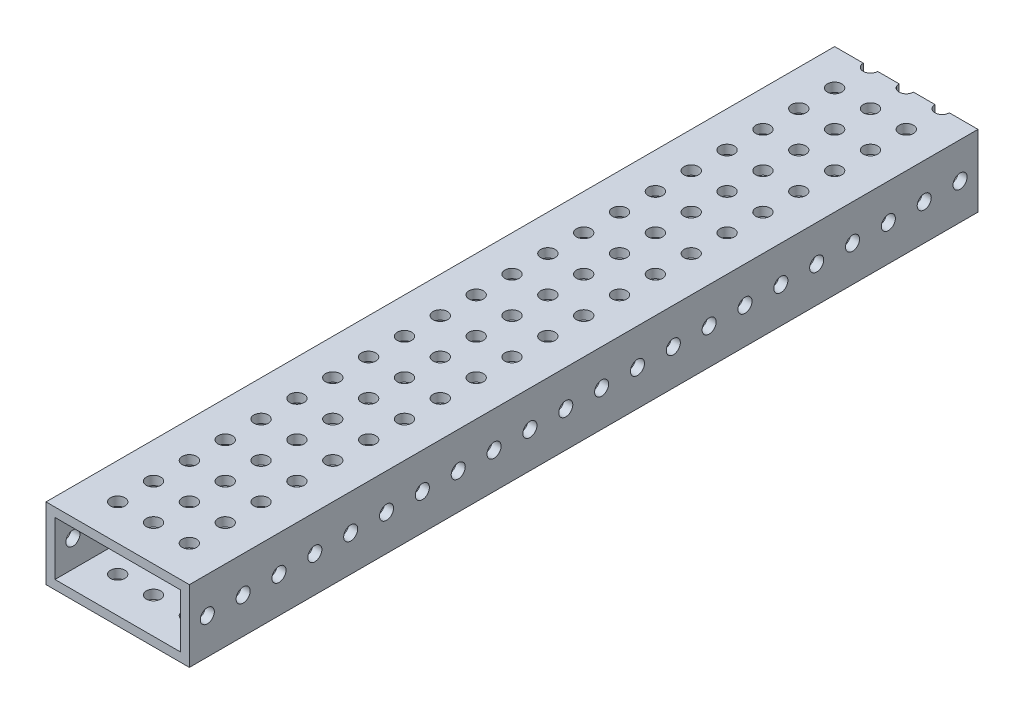
from build123d import *

# Parameters (mm, degrees)
SKETCH1_W           = 50.8
SKETCH1_H           = 25.4
SKETCH1_W_2         = 44.45
SKETCH1_H_2         = 19.05
BOSS_EXTRUDE1_DEPTH = 139.7
SKETCH2_R           = 2.5527
CUT_EXTRUDE1_DEPTH  = 145.244271983
SKETCH4_R           = 2.4892
CUT_EXTRUDE3_DEPTH  = 150.191219581


with BuildPart() as part:
    # Sketch1 → Boss-Extrude1 (new, symmetric)
    with BuildSketch(Plane.XY):
        Rectangle(SKETCH1_W, SKETCH1_H)
        Rectangle(SKETCH1_W_2, SKETCH1_H_2, mode=Mode.SUBTRACT)
    extrude(amount=BOSS_EXTRUDE1_DEPTH, both=True)

    # Sketch2 → Cut-Extrude1 (cut, through all)
    with BuildSketch(Plane(origin=(0, 12.7, 0), x_dir=(1, 0, 0), z_dir=(0, 1, 0))):
        with Locations((0, -127)):
            Circle(SKETCH2_R)
        with Locations((12.7, -127)):
            Circle(SKETCH2_R)
        with Locations((-12.7, -127)):
            Circle(SKETCH2_R)
        with Locations((-12.7, -114.3)):
            Circle(SKETCH2_R)
        with Locations((0, -114.3)):
            Circle(SKETCH2_R)
        with Locations((12.7, -114.3)):
            Circle(SKETCH2_R)
        with Locations((-12.7, -101.6)):
            Circle(SKETCH2_R)
        with Locations((0, -101.6)):
            Circle(SKETCH2_R)
        with Locations((12.7, -101.6)):
            Circle(SKETCH2_R)
        with Locations((-12.7, -88.9)):
            Circle(SKETCH2_R)
        with Locations((0, -88.9)):
            Circle(SKETCH2_R)
        with Locations((12.7, -88.9)):
            Circle(SKETCH2_R)
        with Locations((-12.7, -76.2)):
            Circle(SKETCH2_R)
        with Locations((0, -76.2)):
            Circle(SKETCH2_R)
        with Locations((12.7, -76.2)):
            Circle(SKETCH2_R)
        with Locations((-12.7, -63.5)):
            Circle(SKETCH2_R)
        with Locations((0, -63.5)):
            Circle(SKETCH2_R)
        with Locations((12.7, -63.5)):
            Circle(SKETCH2_R)
        with Locations((-12.7, -50.8)):
            Circle(SKETCH2_R)
        with Locations((0, -50.8)):
            Circle(SKETCH2_R)
        with Locations((12.7, -50.8)):
            Circle(SKETCH2_R)
        with Locations((-12.7, -38.1)):
            Circle(SKETCH2_R)
        with Locations((0, -38.1)):
            Circle(SKETCH2_R)
        with Locations((12.7, -38.1)):
            Circle(SKETCH2_R)
        with Locations((-12.7, -25.4)):
            Circle(SKETCH2_R)
        with Locations((0, -25.4)):
            Circle(SKETCH2_R)
        with Locations((12.7, -25.4)):
            Circle(SKETCH2_R)
        with Locations((-12.7, -12.7)):
            Circle(SKETCH2_R)
        with Locations((0, -12.7)):
            Circle(SKETCH2_R)
        with Locations((12.7, -12.7)):
            Circle(SKETCH2_R)
        with Locations((-12.7, 0)):
            Circle(SKETCH2_R)
        Circle(SKETCH2_R)
        with Locations((12.7, 0)):
            Circle(SKETCH2_R)
        with Locations((-12.7, 12.7)):
            Circle(SKETCH2_R)
        with Locations((0, 12.7)):
            Circle(SKETCH2_R)
        with Locations((12.7, 12.7)):
            Circle(SKETCH2_R)
        with Locations((-12.7, 25.4)):
            Circle(SKETCH2_R)
        with Locations((0, 25.4)):
            Circle(SKETCH2_R)
        with Locations((12.7, 25.4)):
            Circle(SKETCH2_R)
        with Locations((-12.7, 38.1)):
            Circle(SKETCH2_R)
        with Locations((0, 38.1)):
            Circle(SKETCH2_R)
        with Locations((12.7, 38.1)):
            Circle(SKETCH2_R)
        with Locations((-12.7, 50.8)):
            Circle(SKETCH2_R)
        with Locations((0, 50.8)):
            Circle(SKETCH2_R)
        with Locations((12.7, 50.8)):
            Circle(SKETCH2_R)
        with Locations((-12.7, 63.5)):
            Circle(SKETCH2_R)
        with Locations((0, 63.5)):
            Circle(SKETCH2_R)
        with Locations((12.7, 63.5)):
            Circle(SKETCH2_R)
        with Locations((-12.7, 76.2)):
            Circle(SKETCH2_R)
        with Locations((0, 76.2)):
            Circle(SKETCH2_R)
        with Locations((12.7, 76.2)):
            Circle(SKETCH2_R)
        with Locations((-12.7, 88.9)):
            Circle(SKETCH2_R)
        with Locations((0, 88.9)):
            Circle(SKETCH2_R)
        with Locations((12.7, 88.9)):
            Circle(SKETCH2_R)
        with Locations((-12.7, 101.6)):
            Circle(SKETCH2_R)
        with Locations((0, 101.6)):
            Circle(SKETCH2_R)
        with Locations((12.7, 101.6)):
            Circle(SKETCH2_R)
        with Locations((-12.7, 114.3)):
            Circle(SKETCH2_R)
        with Locations((0, 114.3)):
            Circle(SKETCH2_R)
        with Locations((12.7, 114.3)):
            Circle(SKETCH2_R)
        with Locations((-12.7, 127)):
            Circle(SKETCH2_R)
        with Locations((0, 127)):
            Circle(SKETCH2_R)
        with Locations((12.7, 127)):
            Circle(SKETCH2_R)
        with Locations((-12.7, 139.7)):
            Circle(SKETCH2_R)
        with Locations((0, 139.7)):
            Circle(SKETCH2_R)
        with Locations((12.7, 139.7)):
            Circle(SKETCH2_R)
        with Locations((-12.7, 152.4)):
            Circle(SKETCH2_R)
        with Locations((0, 152.4)):
            Circle(SKETCH2_R)
        with Locations((12.7, 152.4)):
            Circle(SKETCH2_R)
        with Locations((-12.7, 165.1)):
            Circle(SKETCH2_R)
        with Locations((0, 165.1)):
            Circle(SKETCH2_R)
        with Locations((12.7, 165.1)):
            Circle(SKETCH2_R)
        with Locations((-12.7, 177.8)):
            Circle(SKETCH2_R)
        with Locations((0, 177.8)):
            Circle(SKETCH2_R)
        with Locations((12.7, 177.8)):
            Circle(SKETCH2_R)
        with Locations((-12.7, 203.2)):
            Circle(SKETCH2_R)
        with Locations((0, 203.2)):
            Circle(SKETCH2_R)
        with Locations((12.7, 203.2)):
            Circle(SKETCH2_R)
        with Locations((-12.7, 215.9)):
            Circle(SKETCH2_R)
        with Locations((0, 215.9)):
            Circle(SKETCH2_R)
        with Locations((12.7, 215.9)):
            Circle(SKETCH2_R)
        with Locations((-12.7, 228.6)):
            Circle(SKETCH2_R)
        with Locations((0, 228.6)):
            Circle(SKETCH2_R)
        with Locations((12.7, 228.6)):
            Circle(SKETCH2_R)
        with Locations((-12.7, 241.3)):
            Circle(SKETCH2_R)
        with Locations((0, 241.3)):
            Circle(SKETCH2_R)
        with Locations((12.7, 241.3)):
            Circle(SKETCH2_R)
        with Locations((-12.7, 254)):
            Circle(SKETCH2_R)
        with Locations((0, 254)):
            Circle(SKETCH2_R)
        with Locations((12.7, 254)):
            Circle(SKETCH2_R)
        with Locations((-12.7, 266.7)):
            Circle(SKETCH2_R)
        with Locations((0, 266.7)):
            Circle(SKETCH2_R)
        with Locations((12.7, 266.7)):
            Circle(SKETCH2_R)
        with Locations((-12.7, 279.4)):
            Circle(SKETCH2_R)
        with Locations((0, 279.4)):
            Circle(SKETCH2_R)
        with Locations((12.7, 279.4)):
            Circle(SKETCH2_R)
        with Locations((-12.7, 292.1)):
            Circle(SKETCH2_R)
        with Locations((0, 292.1)):
            Circle(SKETCH2_R)
        with Locations((12.7, 292.1)):
            Circle(SKETCH2_R)
        with Locations((12.7, 304.8)):
            Circle(SKETCH2_R)
        with Locations((0, 304.8)):
            Circle(SKETCH2_R)
        with Locations((-12.7, 304.8)):
            Circle(SKETCH2_R)
        with Locations((12.7, 317.5)):
            Circle(SKETCH2_R)
        with Locations((0, 317.5)):
            Circle(SKETCH2_R)
        with Locations((-12.7, 317.5)):
            Circle(SKETCH2_R)
        with Locations((12.7, 330.2)):
            Circle(SKETCH2_R)
        with Locations((0, 330.2)):
            Circle(SKETCH2_R)
        with Locations((-12.7, 330.2)):
            Circle(SKETCH2_R)
        with Locations((12.7, 342.9)):
            Circle(SKETCH2_R)
        with Locations((0, 342.9)):
            Circle(SKETCH2_R)
        with Locations((-12.7, 342.9)):
            Circle(SKETCH2_R)
        with Locations((12.7, 355.6)):
            Circle(SKETCH2_R)
        with Locations((0, 355.6)):
            Circle(SKETCH2_R)
        with Locations((-12.7, 355.6)):
            Circle(SKETCH2_R)
        with Locations((12.7, 368.3)):
            Circle(SKETCH2_R)
        with Locations((0, 368.3)):
            Circle(SKETCH2_R)
        with Locations((-12.7, 368.3)):
            Circle(SKETCH2_R)
        with Locations((12.7, 381)):
            Circle(SKETCH2_R)
        with Locations((0, 381)):
            Circle(SKETCH2_R)
        with Locations((-12.7, 381)):
            Circle(SKETCH2_R)
        with Locations((12.7, 393.7)):
            Circle(SKETCH2_R)
        with Locations((0, 393.7)):
            Circle(SKETCH2_R)
        with Locations((-12.7, 393.7)):
            Circle(SKETCH2_R)
        with Locations((12.7, 406.4)):
            Circle(SKETCH2_R)
        with Locations((0, 406.4)):
            Circle(SKETCH2_R)
        with Locations((-12.7, 406.4)):
            Circle(SKETCH2_R)
        with Locations((12.7, 419.1)):
            Circle(SKETCH2_R)
        with Locations((0, 419.1)):
            Circle(SKETCH2_R)
        with Locations((-12.7, 419.1)):
            Circle(SKETCH2_R)
        with Locations((12.7, 431.8)):
            Circle(SKETCH2_R)
        with Locations((0, 431.8)):
            Circle(SKETCH2_R)
        with Locations((-12.7, 431.8)):
            Circle(SKETCH2_R)
        with Locations((12.7, 444.5)):
            Circle(SKETCH2_R)
        with Locations((0, 444.5)):
            Circle(SKETCH2_R)
        with Locations((-12.7, 444.5)):
            Circle(SKETCH2_R)
        with Locations((12.7, 457.2)):
            Circle(SKETCH2_R)
        with Locations((0, 457.2)):
            Circle(SKETCH2_R)
        with Locations((-12.7, 457.2)):
            Circle(SKETCH2_R)
    extrude(amount=-CUT_EXTRUDE1_DEPTH, mode=Mode.SUBTRACT)

    # Sketch4 → Cut-Extrude3 (cut, through all)
    with BuildSketch(Plane(origin=(25.4, 0, 0), x_dir=(0, 0, -1), z_dir=(1, 0, 0))):
        with Locations((-133.35, 0)):
            Circle(SKETCH4_R)
        with Locations((-120.65, 0)):
            Circle(SKETCH4_R)
        with Locations((-107.95, 0)):
            Circle(SKETCH4_R)
        with Locations((-95.25, 0)):
            Circle(SKETCH4_R)
        with Locations((-82.55, 0)):
            Circle(SKETCH4_R)
        with Locations((298.45, 0)):
            Circle(SKETCH4_R)
        with Locations((311.15, 0)):
            Circle(SKETCH4_R)
        with Locations((323.85, 0)):
            Circle(SKETCH4_R)
        with Locations((336.55, 0)):
            Circle(SKETCH4_R)
        with Locations((349.25, 0)):
            Circle(SKETCH4_R)
        with Locations((361.95, 0)):
            Circle(SKETCH4_R)
        with Locations((374.65, 0)):
            Circle(SKETCH4_R)
        with Locations((387.35, 0)):
            Circle(SKETCH4_R)
        with Locations((400.05, 0)):
            Circle(SKETCH4_R)
        with Locations((412.75, 0)):
            Circle(SKETCH4_R)
        with Locations((425.45, 0)):
            Circle(SKETCH4_R)
        with Locations((438.15, 0)):
            Circle(SKETCH4_R)
        with Locations((450.85, 0)):
            Circle(SKETCH4_R)
        with Locations((463.55, 0)):
            Circle(SKETCH4_R)
        with Locations((-69.85, 0)):
            Circle(SKETCH4_R)
        with Locations((-57.15, 0)):
            Circle(SKETCH4_R)
        with Locations((-44.45, 0)):
            Circle(SKETCH4_R)
        with Locations((-31.75, 0)):
            Circle(SKETCH4_R)
        with Locations((-19.05, 0)):
            Circle(SKETCH4_R)
        with Locations((-6.35, 0)):
            Circle(SKETCH4_R)
        with Locations((6.35, 0)):
            Circle(SKETCH4_R)
        with Locations((19.05, 0)):
            Circle(SKETCH4_R)
        with Locations((31.75, 0)):
            Circle(SKETCH4_R)
        with Locations((44.45, 0)):
            Circle(SKETCH4_R)
        with Locations((57.15, 0)):
            Circle(SKETCH4_R)
        with Locations((69.85, 0)):
            Circle(SKETCH4_R)
        with Locations((82.55, 0)):
            Circle(SKETCH4_R)
        with Locations((95.25, 0)):
            Circle(SKETCH4_R)
        with Locations((107.95, 0)):
            Circle(SKETCH4_R)
        with Locations((120.65, 0)):
            Circle(SKETCH4_R)
        with Locations((133.35, 0)):
            Circle(SKETCH4_R)
        with Locations((146.05, 0)):
            Circle(SKETCH4_R)
        with Locations((158.75, 0)):
            Circle(SKETCH4_R)
        with Locations((171.45, 0)):
            Circle(SKETCH4_R)
        with Locations((184.15, 0)):
            Circle(SKETCH4_R)
        with Locations((196.85, 0)):
            Circle(SKETCH4_R)
        with Locations((209.55, 0)):
            Circle(SKETCH4_R)
        with Locations((222.25, 0)):
            Circle(SKETCH4_R)
        with Locations((234.95, 0)):
            Circle(SKETCH4_R)
        with Locations((247.65, 0)):
            Circle(SKETCH4_R)
        with Locations((260.35, 0)):
            Circle(SKETCH4_R)
        with Locations((273.05, 0)):
            Circle(SKETCH4_R)
        with Locations((285.75, 0)):
            Circle(SKETCH4_R)
    extrude(amount=-CUT_EXTRUDE3_DEPTH, mode=Mode.SUBTRACT)


solid = part.part
